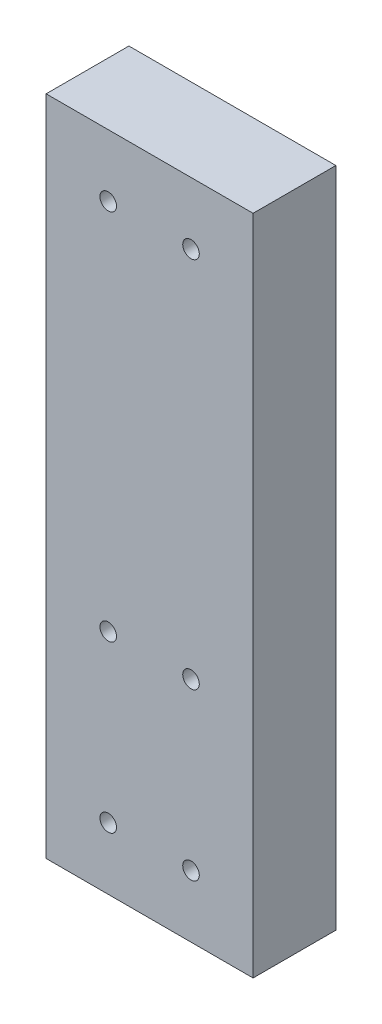
from build123d import *

# Parameters (mm, degrees)
SKETCH1_W           = 25
SKETCH1_H           = 80
BOSS_EXTRUDE1_DEPTH = 10
SKETCH2_R           = 1
CUT_EXTRUDE1_DEPTH  = 85.409715081


with BuildPart() as part:
    # Sketch1 → Boss-Extrude1 (new body)
    with BuildSketch(Plane.XY):
        with Locations((12.5, -40)):
            Rectangle(SKETCH1_W, SKETCH1_H)
    extrude(amount=BOSS_EXTRUDE1_DEPTH)

    # Sketch2 → Cut-Extrude1 (cut, through all)
    with BuildSketch(Plane.XY.offset(10)):
        with Locations((7.5, -7.5)):
            Circle(SKETCH2_R)
        with Locations((7.5, -72.5)):
            Circle(SKETCH2_R)
        with Locations((7.5, -52.5)):
            Circle(SKETCH2_R)
        with Locations((17.5, -72.5)):
            Circle(SKETCH2_R)
        with Locations((17.5, -52.5)):
            Circle(SKETCH2_R)
        with Locations((17.5, -7.5)):
            Circle(SKETCH2_R)
    extrude(amount=-CUT_EXTRUDE1_DEPTH, mode=Mode.SUBTRACT)


solid = part.part
